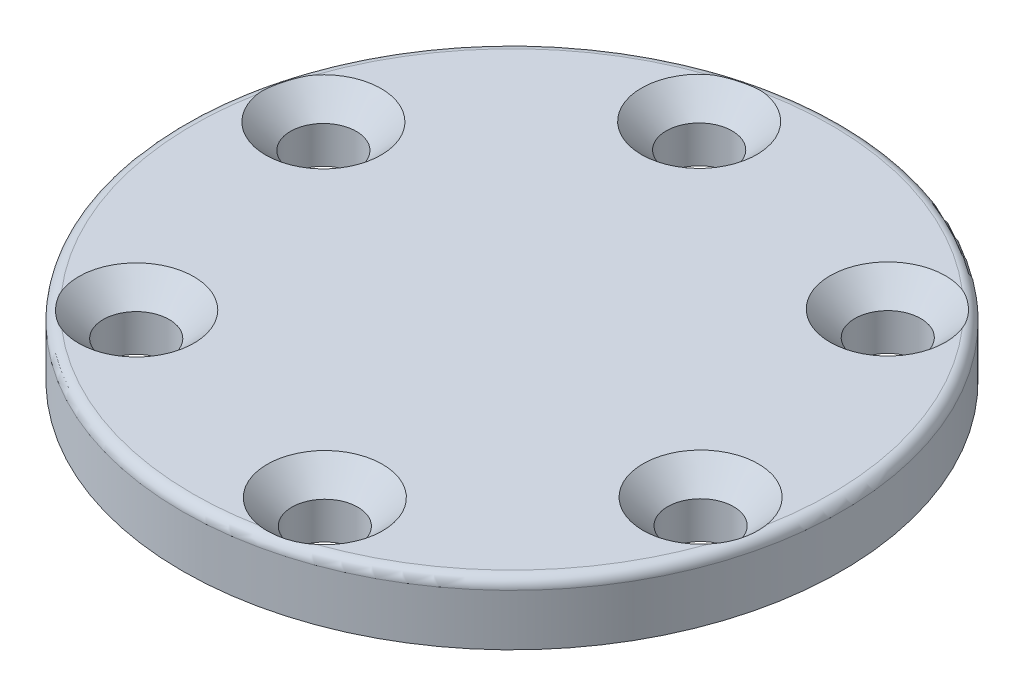
from build123d import *

# Parameters (mm, degrees)
SKETCH1_R           = 16
SKETCH1_R_2         = 1.6
BOSS_EXTRUDE1_DEPTH = 3
CHAMFER1_SIZE       = 1.2
FILLET1_R           = 0.5


with BuildPart() as part:
    # Sketch1 → Boss-Extrude1 (new body)
    with BuildSketch(Plane(origin=(0, 0, 0), x_dir=(1, 0, 0), z_dir=(0, 1, 0))):
        with Locations(Location((27.13838664, -2.073844751, 0), (0, 0, 270))):
            Circle(SKETCH1_R)
        with Locations(Location((23.771761103, 10.379099981, 0), (0, 0, 270))):
            Circle(SKETCH1_R_2, mode=Mode.SUBTRACT)
        with Locations(Location((36.239640361, 7.068210855, 0), (0, 0, 270))):
            Circle(SKETCH1_R_2, mode=Mode.SUBTRACT)
        with Locations(Location((39.606265898, -5.384733876, 0), (0, 0, 270))):
            Circle(SKETCH1_R_2, mode=Mode.SUBTRACT)
        with Locations(Location((30.505012177, -14.526789483, 0), (0, 0, 270))):
            Circle(SKETCH1_R_2, mode=Mode.SUBTRACT)
        with Locations(Location((18.037132919, -11.215900357, 0), (0, 0, 270))):
            Circle(SKETCH1_R_2, mode=Mode.SUBTRACT)
        with Locations(Location((14.670507382, 1.237044374, 0), (0, 0, 270))):
            Circle(SKETCH1_R_2, mode=Mode.SUBTRACT)
    extrude(amount=BOSS_EXTRUDE1_DEPTH)

    # Chamfer1
    chamfer1_edges = [part.edges().sort_by_distance(p)[0] for p in [
        (39.606265898, 3, 3.784733876),
        (30.505012177, 3, 12.926789483),
        (18.037132919, 3, 9.615900357),
        (14.670507382, 3, -2.837044374),
        (23.771761103, 3, -11.979099981),
        (36.239640361, 3, -8.668210855),
    ]]
    chamfer(chamfer1_edges, length=CHAMFER1_SIZE)

    # Fillet1
    # the kernel refuses this fillet: 0.5 mm, written as the material it takes off along each edge
    with BuildSketch(Plane(origin=(27.13838664, 3, 2.073844751), x_dir=(0, 0, 1), z_dir=(-1, 0, 0))) as fillet1_piece_1:
        with BuildLine():
            CenterArc((16 - FILLET1_R, -FILLET1_R), FILLET1_R, 0, 90)
            Line((16, -FILLET1_R), (16, 0))
            Line((16, 0), (16 - FILLET1_R, 0))
        make_face()
    revolve(axis=Axis((27.13838664, 3, 2.073844751), (0, 1, 0)), mode=Mode.SUBTRACT)


solid = part.part
